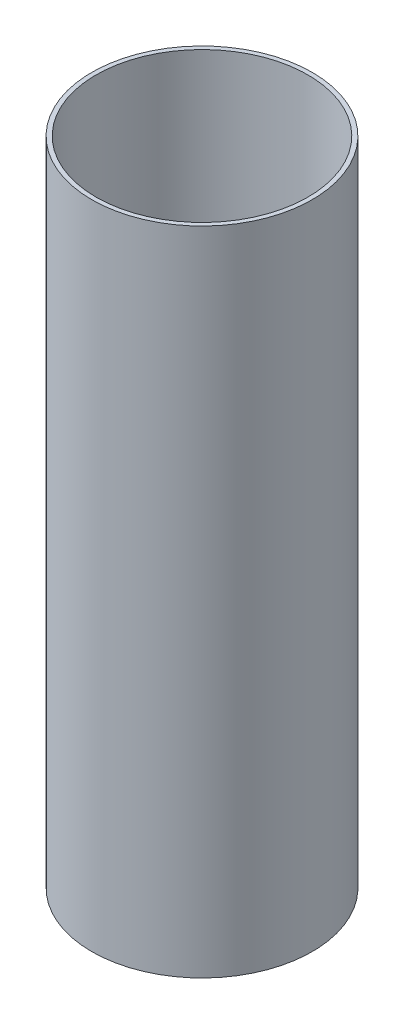
from build123d import *

# Parameters (mm, degrees)
SKETCH1_R           = 25.4
SKETCH1_R_2         = 24.4
BOSS_EXTRUDE1_DEPTH = 150


with BuildPart() as part:
    # Sketch1 → Boss-Extrude1 (new body)
    with BuildSketch(Plane(origin=(0, 0, 0), x_dir=(1, 0, 0), z_dir=(0, 1, 0))):
        Circle(SKETCH1_R)
        Circle(SKETCH1_R_2, mode=Mode.SUBTRACT)
    extrude(amount=BOSS_EXTRUDE1_DEPTH)


solid = part.part
